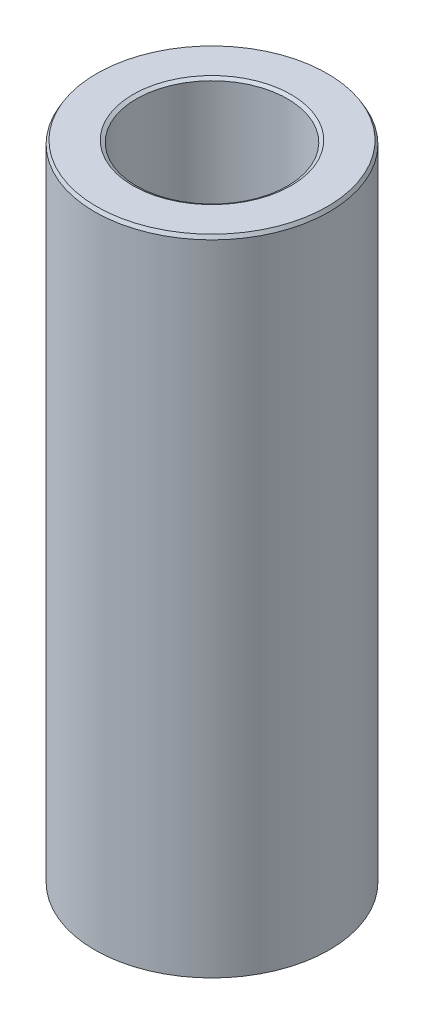
from build123d import *
from OCP.BRepFilletAPI import BRepFilletAPI_MakeChamfer

# Parameters (mm, degrees)
SKETCH1_R           = 40
BOSS_EXTRUDE1_DEPTH = 219.810319967
SKETCH2_R           = 25.758446544
CUT_EXTRUDE1_DEPTH  = 227.972634394
CHAMFER1_SIZE       = 1.195311316
CHAMFER1_SIZE2      = 0.69011331


with BuildPart() as part:
    # Sketch1 → Boss-Extrude1 (new body)
    with BuildSketch(Plane(origin=(0, 0, 0), x_dir=(1, 0, 0), z_dir=(0, 1, 0))):
        Circle(SKETCH1_R)
    extrude(amount=BOSS_EXTRUDE1_DEPTH)

    # Sketch2 → Cut-Extrude1 (cut, through all)
    with BuildSketch(Plane(origin=(0, 0, 0), x_dir=(1, 0, 0), z_dir=(0, 1, 0))):
        Circle(SKETCH2_R)
    extrude(amount=CUT_EXTRUDE1_DEPTH, mode=Mode.SUBTRACT)

    # Chamfer1: one chamfer whose edges measure the first distance from different faces: ONE call of the kernel's chamfer builder (chamfer() names one face for all edges)
    chamfer1_edges_1 = [part.edges().sort_by_distance(p)[0] for p in [
        (-25.758446544, 219.810319967, 0),
    ]]
    chamfer1_side_1 = [part.faces().sort_by_distance(p)[0] for p in [
        (-38.86862915, 219.810319967, 0),
    ]]
    chamfer1_edges_2 = [part.edges().sort_by_distance(p)[0] for p in [
        (-25.758446544, 0, 0),
    ]]
    chamfer1_side_2 = [part.faces().sort_by_distance(p)[0] for p in [
        (-25.758446544, 109.905159983, 0),
    ]]
    chamfer1_edges_3 = [part.edges().sort_by_distance(p)[0] for p in [
        (-40, 0, 0),
    ]]
    chamfer1_side_3 = [part.faces().sort_by_distance(p)[0] for p in [
        (-38.86862915, 0, 0),
    ]]
    chamfer1_edges_4 = [part.edges().sort_by_distance(p)[0] for p in [
        (-40, 219.810319967, 0),
    ]]
    chamfer1_side_4 = [part.faces().sort_by_distance(p)[0] for p in [
        (-40, 109.905159983, 0),
    ]]
    chamfer1 = BRepFilletAPI_MakeChamfer(part.part.solid().wrapped)
    for e in chamfer1_edges_1:
        chamfer1.Add(CHAMFER1_SIZE, CHAMFER1_SIZE2, e.wrapped, chamfer1_side_1[0].wrapped)  # the first distance lies on this face
    for e in chamfer1_edges_2:
        chamfer1.Add(CHAMFER1_SIZE, CHAMFER1_SIZE2, e.wrapped, chamfer1_side_2[0].wrapped)  # the first distance lies on this face
    for e in chamfer1_edges_3:
        chamfer1.Add(CHAMFER1_SIZE, CHAMFER1_SIZE2, e.wrapped, chamfer1_side_3[0].wrapped)  # the first distance lies on this face
    for e in chamfer1_edges_4:
        chamfer1.Add(CHAMFER1_SIZE, CHAMFER1_SIZE2, e.wrapped, chamfer1_side_4[0].wrapped)  # the first distance lies on this face
    add(Compound.cast(chamfer1.Shape()), mode=Mode.REPLACE)


solid = part.part
